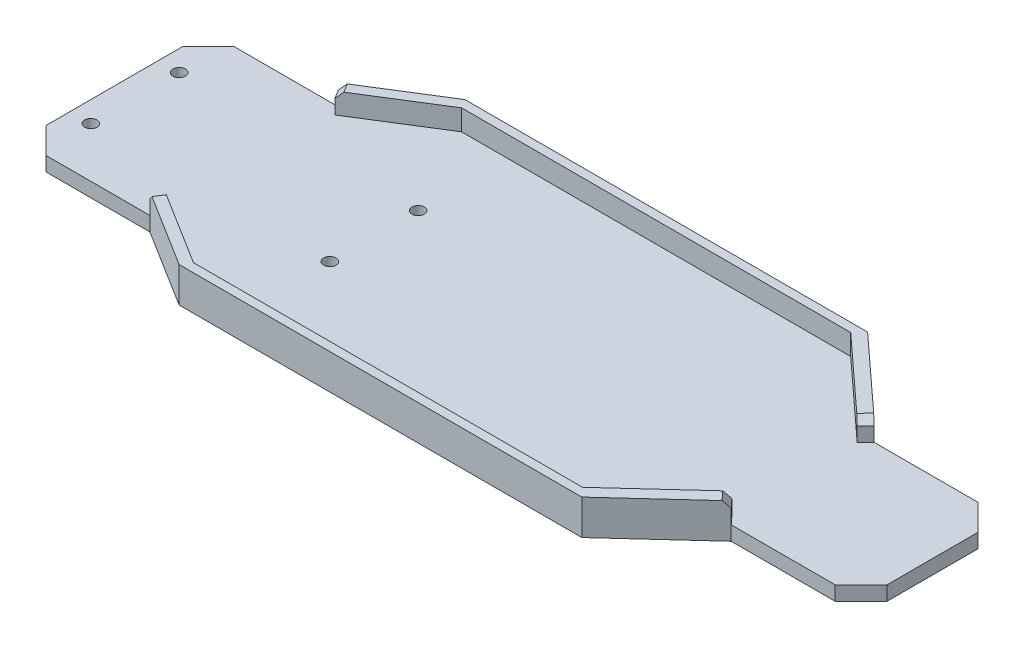
from build123d import *

# Parameters (mm, degrees)
BOSS_EXTRUDE1_DEPTH  = 5.5
CHASSIS_WALLS1_DEPTH = 8
CHAMFER1_SIZE        = 10
CHAMFER2_SIZE        = 10
CHAMFER3_SIZE        = 2.5
SKETCH4_R            = 2.4
CUT_EXTRUDE1_DEPTH   = 10


with BuildPart() as part:
    # Sketch1 → Boss-Extrude1 (new body)
    with BuildSketch(Plane(origin=(0, 0, 0), x_dir=(1, 0, 0), z_dir=(0, 1, 0))):
        Polygon((-107.5, 36.25), (-77.5, 55), (77.5, 55), (107.5, 27.5), (157.5, 27.5), (157.5, -27.5), (107.5, -27.5), (77.5, -55), (-77.5, -55), (-107.5, -36.25), (-157.5, -36.25), (-157.5, 36.25), align=None)
    extrude(amount=BOSS_EXTRUDE1_DEPTH)

    # Sketch3 → Chassis-Walls1 (add)
    with BuildSketch(Plane(origin=(0, 5.5, 0), x_dir=(1, 0, 0), z_dir=(0, 1, 0))):
        Polygon((0, 55), (-77.5, 55), (-107.5, 36.25), (-105.38000424, 32.858006784), (-75.38000424, 51.608006784), (0, 51.608006784), (74.390672885, 51.608006784), (104.390672885, 24.108006784), (107.5, 27.5), (77.5, 55), align=None)
        Polygon((74.390672885, -51.608006784), (0, -51.608006784), (-75.38000424, -51.608006784), (-105.38000424, -32.858006784), (-107.5, -36.25), (-77.5, -55), (0, -55), (77.5, -55), (107.5, -27.5), (104.390672885, -24.108006784), align=None)
    extrude(amount=CHASSIS_WALLS1_DEPTH)

    # Chamfer1
    chamfer1_edges = [part.edges().sort_by_distance(p)[0] for p in [
        (-157.5, 2.75, -36.25),
        (-157.5, 2.75, 36.25),
    ]]
    chamfer(chamfer1_edges, length=CHAMFER1_SIZE)

    # Chamfer2
    chamfer2_edges = [part.edges().sort_by_distance(p)[0] for p in [
        (157.5, 2.75, -27.5),
        (157.5, 2.75, 27.5),
    ]]
    chamfer(chamfer2_edges, length=CHAMFER2_SIZE)

    # Chamfer3
    chamfer3_edges = [part.edges().sort_by_distance(p)[0] for p in [
        (-106.44000212, 13.5, -34.554003392),
        (-106.44000212, 13.5, 34.554003392),
        (105.945336443, 13.5, 25.804003392),
        (105.945336443, 13.5, -25.804003392),
    ]]
    chamfer(chamfer3_edges, length=CHAMFER3_SIZE)

    # Sketch4 → Cut-Extrude1 (cut)
    with BuildSketch(Plane.XZ):
        with Locations((-149.5, 17)):
            Circle(SKETCH4_R)
        with Locations((-57.5, 17)):
            Circle(SKETCH4_R)
        with Locations((-57.5, -17)):
            Circle(SKETCH4_R)
        with Locations((-149.5, -17)):
            Circle(SKETCH4_R)
    extrude(amount=-CUT_EXTRUDE1_DEPTH, mode=Mode.SUBTRACT)


solid = part.part
